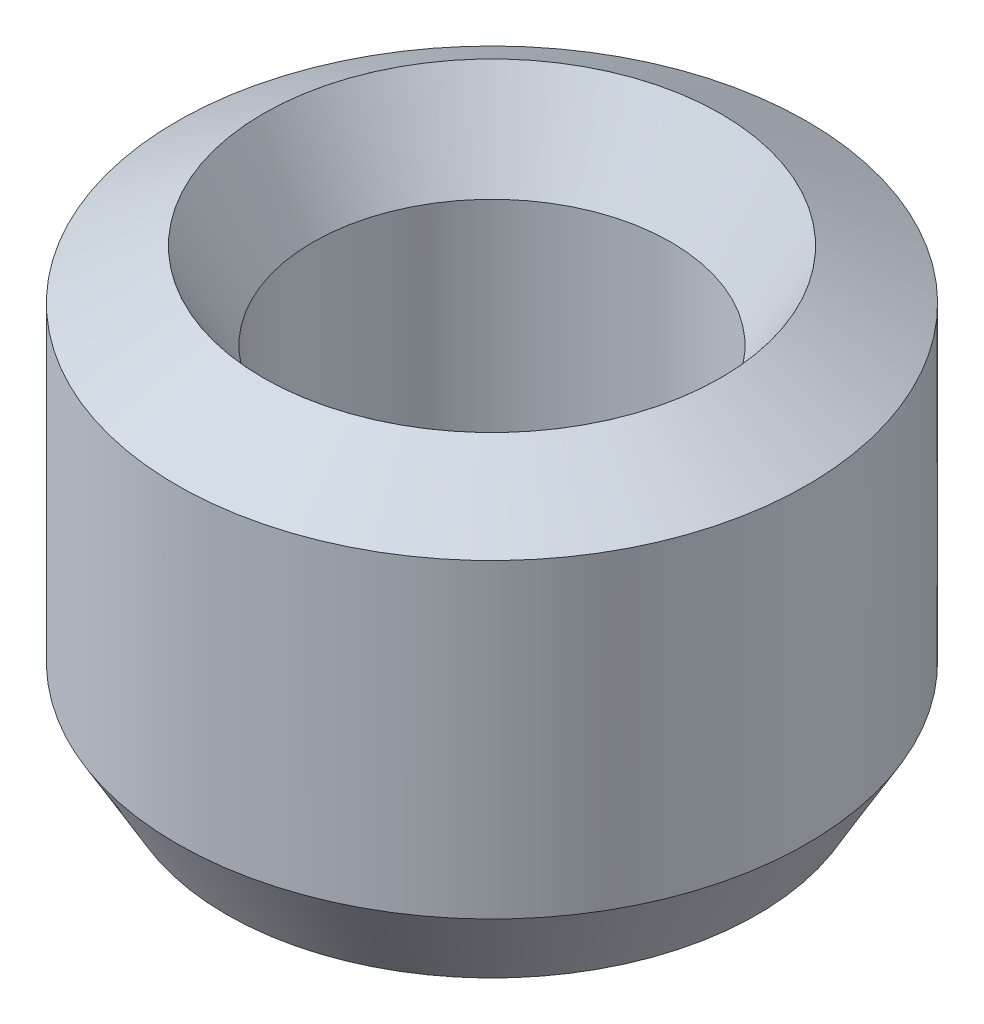
from build123d import *
from OCP.BRepFilletAPI import BRepFilletAPI_MakeChamfer

# Parameters (mm, degrees)
SKETCH1_R           = 25
BOSS_EXTRUDE1_DEPTH = 35.430724015
SKETCH2_R           = 14.199134796
CUT_EXTRUDE1_DEPTH  = 51.053333598
CHAMFER1_SIZE       = 3.952587636
CHAMFER1_SIZE2      = 6.846082607


with BuildPart() as part:
    # Sketch1 → Boss-Extrude1 (new body)
    with BuildSketch(Plane(origin=(0, 0, 0), x_dir=(1, 0, 0), z_dir=(0, 1, 0))):
        Circle(SKETCH1_R)
    extrude(amount=BOSS_EXTRUDE1_DEPTH)

    # Sketch2 → Cut-Extrude1 (cut, through all)
    with BuildSketch(Plane(origin=(0, 0, 0), x_dir=(1, 0, 0), z_dir=(0, 1, 0))):
        Circle(SKETCH2_R)
    extrude(amount=CUT_EXTRUDE1_DEPTH, mode=Mode.SUBTRACT)

    # Chamfer1: one chamfer whose edges measure the first distance from different faces: ONE call of the kernel's chamfer builder (chamfer() names one face for all edges)
    chamfer1_edges_1 = [part.edges().sort_by_distance(p)[0] for p in [
        (-14.199134796, 35.430724015, 0),
    ]]
    chamfer1_side_1 = [part.faces().sort_by_distance(p)[0] for p in [
        (-24.292893219, 35.430724015, 0),
    ]]
    chamfer1_edges_2 = [part.edges().sort_by_distance(p)[0] for p in [
        (-14.199134796, 0, 0),
    ]]
    chamfer1_side_2 = [part.faces().sort_by_distance(p)[0] for p in [
        (-14.199134796, 17.715362008, 0),
    ]]
    chamfer1_edges_3 = [part.edges().sort_by_distance(p)[0] for p in [
        (-25, 0, 0),
    ]]
    chamfer1_side_3 = [part.faces().sort_by_distance(p)[0] for p in [
        (-24.292893219, 0, 0),
    ]]
    chamfer1_edges_4 = [part.edges().sort_by_distance(p)[0] for p in [
        (-25, 35.430724015, 0),
    ]]
    chamfer1_side_4 = [part.faces().sort_by_distance(p)[0] for p in [
        (-25, 17.715362008, 0),
    ]]
    chamfer1 = BRepFilletAPI_MakeChamfer(part.part.solid().wrapped)
    for e in chamfer1_edges_1:
        chamfer1.Add(CHAMFER1_SIZE, CHAMFER1_SIZE2, e.wrapped, chamfer1_side_1[0].wrapped)  # the first distance lies on this face
    for e in chamfer1_edges_2:
        chamfer1.Add(CHAMFER1_SIZE, CHAMFER1_SIZE2, e.wrapped, chamfer1_side_2[0].wrapped)  # the first distance lies on this face
    for e in chamfer1_edges_3:
        chamfer1.Add(CHAMFER1_SIZE, CHAMFER1_SIZE2, e.wrapped, chamfer1_side_3[0].wrapped)  # the first distance lies on this face
    for e in chamfer1_edges_4:
        chamfer1.Add(CHAMFER1_SIZE, CHAMFER1_SIZE2, e.wrapped, chamfer1_side_4[0].wrapped)  # the first distance lies on this face
    add(Compound.cast(chamfer1.Shape()), mode=Mode.REPLACE)


solid = part.part
